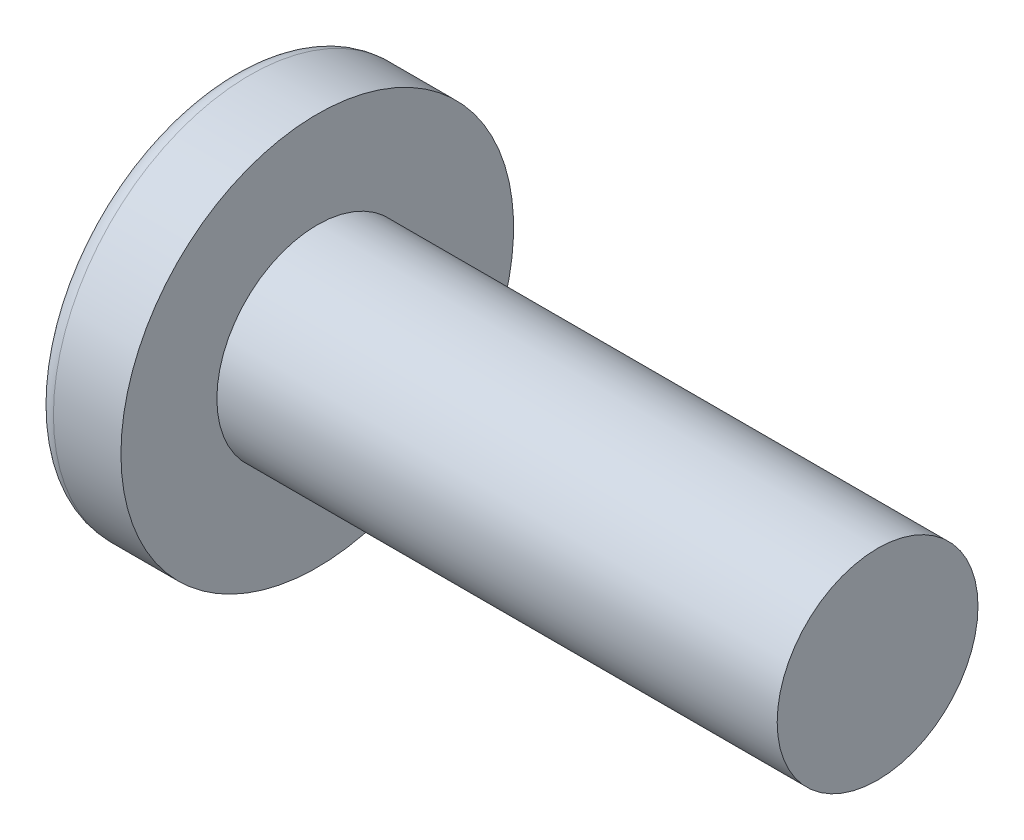
from build123d import *

# Parameters (mm, degrees)
CIRPATTERN1_COUNT = 2
CIRPATTERN1_ANGLE = 90


with BuildPart() as part:
    # BodySke → Base-Revolve (revolve)
    with BuildSketch(Plane.XY):
        with BuildLine():
            Line((2.032, 1.4224), (2.032, 2.7813))
            Line((2.032, 2.7813), (1.075646615, 2.7813))
            ThreePointArc((1.075646615, 2.7813), (0.960371669, 2.753635341), (0.87020729, 2.676667612))
            ThreePointArc((0.87020729, 2.676667612), (0.223015279, 1.407285528), (0, 0))
            Line((0, 0), (9.9695, 0))
            Line((9.9695, 0), (9.9695, 1.4224))
            Line((9.9695, 1.4224), (2.032, 1.4224))
        make_face()
    revolve(axis=Axis((-25.4, 0, 0), (1, 0, 0)))

    # Sketch3 → Cut-Loft1 section 0
    with BuildSketch(Plane(origin=(0, 0, 0), x_dir=(0, 0, -1), z_dir=(1, 0, 0))):
        with BuildLine():
            Line((0.4064, -1.8161), (-0.4064, -1.8161))
            Line((-0.4064, -1.8161), (-0.4064, 1.8161))
            Line((-0.4064, 1.8161), (0.4064, 1.8161))
            Line((0.4064, 1.8161), (0.4064, -1.8161))
        make_face()
    # Sketch4 → Cut-Loft1 section 1
    with BuildSketch(Plane(origin=(2.0066, 0, 0), x_dir=(0, 0, -1), z_dir=(1, 0, 0))):
        with BuildLine():
            Line((0.2032, -0.2032), (-0.2032, -0.2032))
            Line((-0.2032, -0.2032), (-0.2032, 0.2032))
            Line((-0.2032, 0.2032), (0.2032, 0.2032))
            Line((0.2032, 0.2032), (0.2032, -0.2032))
        make_face()
    cut_loft1 = loft(mode=Mode.SUBTRACT)

    # CirPattern1: Cut-Loft1 ×2 about axis
    cirpattern1_axis = Axis((-25.4, 0, 0), (1, 0, 0))
    for i in range(1, CIRPATTERN1_COUNT):
        add(cut_loft1.rotate(cirpattern1_axis, i * CIRPATTERN1_ANGLE / (CIRPATTERN1_COUNT - 1)), mode=Mode.SUBTRACT)


solid = part.part
